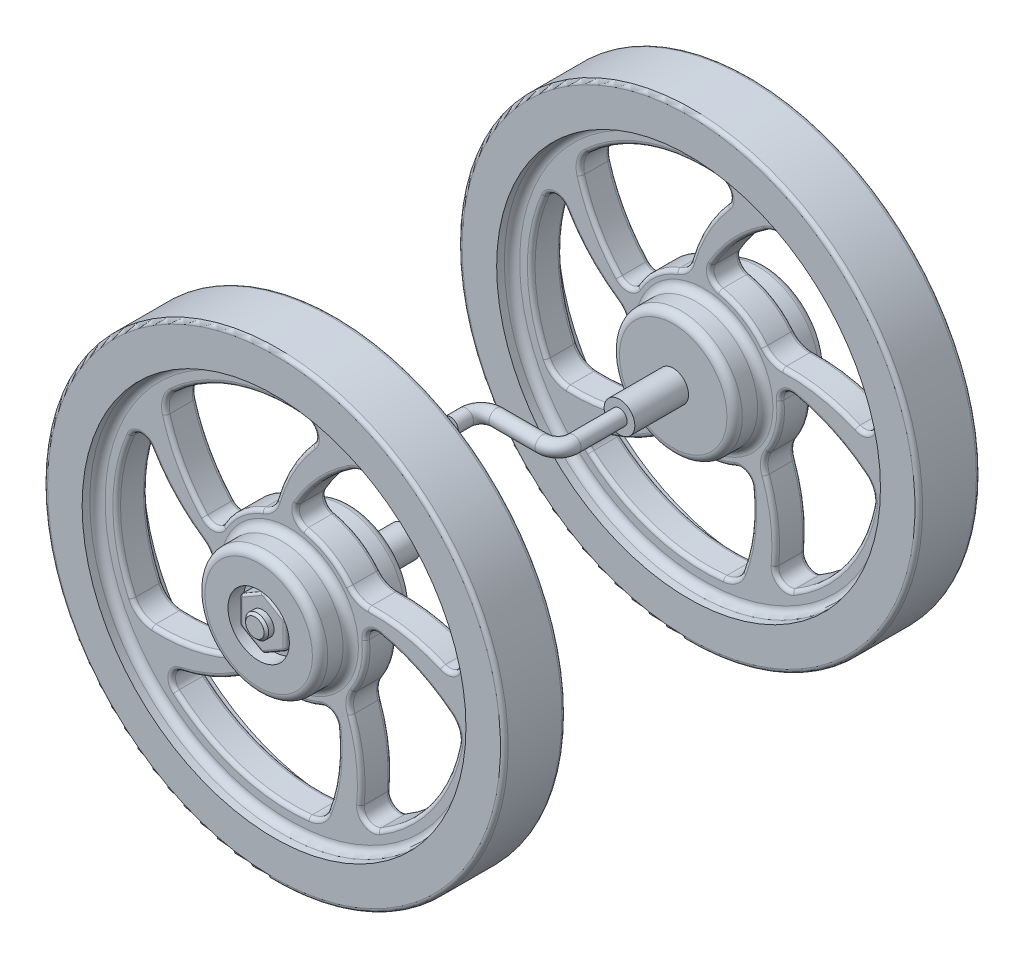
from build123d import *

# Parameters (mm, degrees)
SKETCH_2_R             = 10
SKETCH_3_W             = 5
SKETCH_3_H             = 40
SKETCH_4_W             = 70
SKETCH_4_H             = 20
FILLET_1_R             = 5
EXTRUDE_1_DEPTH        = 15
FILLET_2_R             = 3
FILLET_2_OF_MIRROR_1_R = 3
CUT_EXTRUDE_START      = -40
CUT_EXTRUDE_1_DEPTH    = 40
FILLET_3_R             = 5
FILLET_3_OF_MIRROR_3_R = 5


with BuildPart() as part:
    # По траектории1: sweep along a path in Эскиз1
    with BuildLine(Plane(origin=(0, 0, 0), x_dir=(1, 0, 0), z_dir=(0, 1, 0))) as sweep_1_path:
        Line((0, -140), (0, -80))
        ThreePointArc((0, -80), (-5.857864376, -65.857864376), (-20, -60))
        Line((-20, -60), (-80, -60))
        ThreePointArc((-80, -60), (-94.142135624, -54.142135624), (-100, -40))
        Line((-100, -40), (-100, 40))
        ThreePointArc((-100, 40), (-94.142135624, 54.142135624), (-80, 60))
        Line((-80, 60), (-20, 60))
        ThreePointArc((-20, 60), (-5.857864376, 65.857864376), (0, 80))
        Line((0, 80), (0, 140))
    # Эскиз2 → По траектории1 (sweep)
    with BuildSketch(Plane(origin=(0, 0, 140), x_dir=(-1, 0, 0), z_dir=(0, 0, -1))):
        Circle(SKETCH_2_R)
    sweep(path=sweep_1_path.line)

    # Эскиз3 → Вырез-Повернуть1 (revolve, cut)
    with BuildSketch(Plane(origin=(0, 0, 0), x_dir=(1, 0, 0), z_dir=(0, 1, 0)), mode=Mode.PRIVATE) as cut_revolve_1_sk:
        with Locations((-92.5, 0)):
            Rectangle(SKETCH_3_W, SKETCH_3_H)
    revolve(cut_revolve_1_sk.sketch.rotate(Axis((-100, 0, -40), (0, 0, 1)), 180), axis=Axis((-100, 0, -40), (0, 0, 1)), mode=Mode.SUBTRACT)

    # Эскиз4 → Повернуть1 (revolve)
    with BuildSketch(Plane(origin=(0, 0, 0), x_dir=(0, 0, -1), z_dir=(1, 0, 0)), mode=Mode.PRIVATE) as revolve_1_sk:
        with Locations((175, 10)):
            Rectangle(SKETCH_4_W, SKETCH_4_H)
        with Locations((-175, 10)):
            Rectangle(SKETCH_4_W, SKETCH_4_H)
    revolve(revolve_1_sk.sketch.rotate(Axis((0, 0, 305.598666539), (0, 0, -1)), 90), axis=Axis((0, 0, 305.598666539), (0, 0, -1)))

    # Эскиз5 → Повернуть2 (revolve)
    with BuildSketch(Plane(origin=(0, 0, 0), x_dir=(0, 0, -1), z_dir=(1, 0, 0)), mode=Mode.PRIVATE) as revolve_2_sk:
        with BuildLine():
            Line((-210, 0), (-210, 70))
            ThreePointArc((-210, 70), (-212.928932188, 77.071067812), (-220, 80))
            Line((-220, 80), (-240, 80))
            ThreePointArc((-240, 80), (-247.071067812, 82.928932188), (-250, 90))
            Line((-250, 90), (-250, 240))
            ThreePointArc((-250, 240), (-247.071067812, 247.071067812), (-240, 250))
            Line((-240, 250), (-230, 250))
            Line((-230, 250), (-230, 300))
            Line((-230, 300), (-310, 300))
            Line((-310, 300), (-310, 250))
            Line((-310, 250), (-300, 250))
            ThreePointArc((-300, 250), (-292.928932188, 247.071067812), (-290, 240))
            Line((-290, 240), (-290, 90))
            ThreePointArc((-290, 90), (-292.928932188, 82.928932188), (-300, 80))
            Line((-300, 80), (-320, 80))
            ThreePointArc((-320, 80), (-327.071067812, 77.071067812), (-330, 70))
            Line((-330, 70), (-330, 40))
            Line((-330, 40), (-310, 40))
            Line((-310, 40), (-310, 0))
            Line((-310, 0), (-210, 0))
        make_face()
        with BuildLine():
            Line((230, 250), (230, 300))
            Line((230, 300), (310, 300))
            Line((310, 300), (310, 250))
            Line((310, 250), (300, 250))
            ThreePointArc((300, 250), (292.928932188, 247.071067812), (290, 240))
            Line((290, 240), (290, 90))
            ThreePointArc((290, 90), (292.928932188, 82.928932188), (300, 80))
            Line((300, 80), (320, 80))
            ThreePointArc((320, 80), (327.071067812, 77.071067812), (330, 70))
            Line((330, 70), (330, 40))
            Line((330, 40), (310, 40))
            Line((310, 40), (310, 0))
            Line((310, 0), (210, 0))
            Line((210, 0), (210, 70))
            ThreePointArc((210, 70), (212.928932188, 77.071067812), (220, 80))
            Line((220, 80), (240, 80))
            ThreePointArc((240, 80), (247.071067812, 82.928932188), (250, 90))
            Line((250, 90), (250, 240))
            ThreePointArc((250, 240), (247.071067812, 247.071067812), (240, 250))
            Line((240, 250), (230, 250))
        make_face()
    revolve(revolve_2_sk.sketch.rotate(Axis((0, 0, 556.938315205), (0, 0, -1)), 90), axis=Axis((0, 0, 556.938315205), (0, 0, -1)))

    # Скругление1
    fillet_1_edges = [part.edges().sort_by_distance(p)[0] for p in [
        (-300, 0, -230),
        (-300, 0, -310),
        (-300, 0, 230),
        (-300, 0, 310),
    ]]
    fillet(fillet_1_edges, radius=FILLET_1_R)

    # Эскиз6 → Бобышка-Вытянуть1 (add)
    with BuildSketch(Plane.XY.offset(310)):
        with BuildLine():
            Line((-2.5, 33.197640478), (-27.5, 18.763883749))
            ThreePointArc((-27.5, 18.763883749), (-29.330127019, 16.93375673), (-30, 14.43375673))
            Line((-30, 14.43375673), (-30, -14.43375673))
            ThreePointArc((-30, -14.43375673), (-29.330127019, -16.93375673), (-27.5, -18.763883749))
            Line((-27.5, -18.763883749), (-2.5, -33.197640478))
            ThreePointArc((-2.5, -33.197640478), (0, -33.867513459), (2.5, -33.197640478))
            Line((2.5, -33.197640478), (27.5, -18.763883749))
            ThreePointArc((27.5, -18.763883749), (29.330127019, -16.93375673), (30, -14.43375673))
            Line((30, -14.43375673), (30, 14.43375673))
            ThreePointArc((30, 14.43375673), (29.330127019, 16.93375673), (27.5, 18.763883749))
            Line((27.5, 18.763883749), (2.5, 33.197640478))
            ThreePointArc((2.5, 33.197640478), (0, 33.867513459), (-2.5, 33.197640478))
        make_face()
    extrude_1 = extrude(amount=EXTRUDE_1_DEPTH)

    # Скругление2
    fillet_2_edges = [part.edges().sort_by_distance(p)[0] for p in [
        (30, 0, 325),
        (29.330127019, 16.93375673, 325),
        (15, 25.980762114, 325),
        (0, 33.867513459, 325),
        (-15, 25.980762114, 325),
        (-29.330127019, 16.93375673, 325),
        (-30, 0, 325),
        (-29.330127019, -16.93375673, 325),
        (-15, -25.980762114, 325),
        (0, -33.867513459, 325),
        (15, -25.980762114, 325),
        (29.330127019, -16.93375673, 325),
    ]]
    fillet(fillet_2_edges, radius=FILLET_2_R)

    # Зеркальное отражение1: Бобышка-Вытянуть1 across plane
    add(extrude_1.mirror(Plane.XY))

    # Скругление2 of Зеркальное отражение1
    fillet_2_of_mirror_1_edges = [part.edges().sort_by_distance(p)[0] for p in [
        (30, 0, -325),
        (29.330127019, 16.93375673, -325),
        (15, 25.980762114, -325),
        (0, 33.867513459, -325),
        (-15, 25.980762114, -325),
        (-29.330127019, 16.93375673, -325),
        (-30, 0, -325),
        (-29.330127019, -16.93375673, -325),
        (-15, -25.980762114, -325),
        (0, -33.867513459, -325),
        (15, -25.980762114, -325),
        (29.330127019, -16.93375673, -325),
    ]]
    fillet(fillet_2_of_mirror_1_edges, radius=FILLET_2_OF_MIRROR_1_R)

    # Эскиз7 → Повернуть3 (revolve)
    with BuildSketch(Plane(origin=(0, 0, 0), x_dir=(0, 0, -1), z_dir=(1, 0, 0)), mode=Mode.PRIVATE) as revolve_3_sk:
        Polygon((-325, 15), (-332, 15), (-335, 12), (-335, 0), (-325, 0), align=None)
        Polygon((325, 0), (335, 0), (335, 12), (332, 15), (325, 15), align=None)
    revolve(revolve_3_sk.sketch.rotate(Axis((0, 0, 417.512746567), (0, 0, -1)), 90), axis=Axis((0, 0, 417.512746567), (0, 0, -1)))

    # Эскиз8 → Вырез-Вытянуть1 (cut)
    with BuildSketch(Plane.XY.offset(290).offset(CUT_EXTRUDE_START)):
        with BuildLine():
            ThreePointArc((20.118614875, 97.955302743), (52.241504939, 85.269133698), (78.132929291, 62.411900791))
            ThreePointArc((78.132929291, 62.411900791), (89.046910737, 53.875575655), (102.632858675, 51.154205332))
            ThreePointArc((102.632858675, 51.154205332), (151.732398041, 47.375313267), (198.761338216, 32.769712379))
            ThreePointArc((198.761338216, 32.769712379), (214.338396594, 34.942139575), (219.413065105, 49.828775433))
            ThreePointArc((219.413065105, 49.828775433), (180.618591446, 134.171250364), (111.074665944, 195.671711255))
            ThreePointArc((111.074665944, 195.671711255), (95.222431523, 199.56403853), (79.678762106, 194.580276011))
            ThreePointArc((79.678762106, 194.580276011), (40.513348034, 161.409749919), (10.099384439, 120.067226059))
            ThreePointArc((10.099384439, 120.067226059), (9.473553871, 106.457762875), (20.118614875, 97.955302743))
        make_face()
        with BuildLine():
            ThreePointArc((117.311599162, 27.497727938), (104.174838235, 23.88737277), (99.378022879, 11.135913461))
            ThreePointArc((99.378022879, 11.135913461), (97.239278081, -23.335012285), (83.501647913, -55.022493544))
            ThreePointArc((83.501647913, -55.022493544), (78.75572601, -68.040176253), (80.365837829, -81.802130247))
            ThreePointArc((80.365837829, -81.802130247), (91.944489986, -129.666308977), (92.586479828, -178.906867872))
            ThreePointArc((92.586479828, -178.906867872), (99.466156631, -193.050213825), (115.19234748, -193.276286911))
            ThreePointArc((115.19234748, -193.276286911), (183.418656215, -130.31729184), (220.418815465, -45.172400745))
            ThreePointArc((220.418815465, -45.172400745), (219.222028848, -28.893234625), (209.678931025, -15.650393854))
            ThreePointArc((209.678931025, -15.650393854), (166.029107496, 11.347872138), (117.311599162, 27.497727938))
        make_face()
        with BuildLine():
            ThreePointArc((62.403171117, -103.07269558), (54.910036931, -91.694554601), (41.300380999, -91.072929728))
            ThreePointArc((41.300380999, -91.072929728), (7.855673956, -99.690964419), (-26.526072764, -96.417671947))
            ThreePointArc((-26.526072764, -96.417671947), (-40.373195254, -95.92671718), (-52.964039362, -101.710702177))
            ThreePointArc((-52.964039362, -101.710702177), (-94.907578152, -127.51349941), (-141.539746783, -143.340237544))
            ThreePointArc((-141.539746783, -143.340237544), (-152.864931066, -154.253733254), (-148.220279119, -169.280089963))
            ThreePointArc((-148.220279119, -169.280089963), (-67.259627734, -214.711766042), (25.151653773, -223.589790269))
            ThreePointArc((25.151653773, -223.589790269), (40.264233388, -217.421039573), (49.909943992, -204.25275135))
            ThreePointArc((49.909943992, -204.25275135), (62.09828352, -154.396379238), (62.403171117, -103.07269558))
        make_face()
        with BuildLine():
            ThreePointArc((-78.744318406, -91.200157119), (-70.238569088, -80.557724097), (-73.852983673, -67.422079488))
            ThreePointArc((-73.852983673, -67.422079488), (-92.384204571, -38.277392097), (-99.89566247, -4.566904835))
            ThreePointArc((-99.89566247, -4.566904835), (-103.707732911, 8.754204607), (-113.099414337, 18.941459282))
            ThreePointArc((-113.099414337, 18.941459282), (-150.600599074, 50.858632317), (-180.062854099, 90.317729114))
            ThreePointArc((-180.062854099, 90.317729114), (-193.941879718, 97.716163782), (-206.797517797, 88.655437695))
            ThreePointArc((-206.797517797, 88.655437695), (-224.987392225, -2.381877359), (-204.87423856, -93.013689178))
            ThreePointArc((-204.87423856, -93.013689178), (-194.337364083, -105.4803577), (-178.832889261, -110.584748776))
            ThreePointArc((-178.832889261, -110.584748776), (-127.650257637, -106.770082247), (-78.744318406, -91.200157119))
        make_face()
        with BuildLine():
            ThreePointArc((-111.069836313, 46.707898701), (-98.319859949, 41.907143052), (-86.94403508, 49.403793012))
            ThreePointArc((-86.94403508, 49.403793012), (-64.952252405, 76.034235102), (-35.21284197, 93.595169535))
            ThreePointArc((-35.21284197, 93.595169535), (-23.721708582, 101.337113171), (-16.935242805, 113.41716781))
            ThreePointArc((-16.935242805, 113.41716781), (1.831289198, 158.945862804), (30.254782839, 199.159663923))
            ThreePointArc((30.254782839, 199.159663923), (33.002257559, 214.645643722), (20.412384331, 224.072163746))
            ThreePointArc((20.412384331, 224.072163746), (-71.790227701, 213.239684877), (-151.770896622, 166.104168938))
            ThreePointArc((-151.770896622, 166.104168938), (-160.371329676, 152.230593369), (-160.434747862, 135.907617969))
            ThreePointArc((-160.434747862, 135.907617969), (-140.990481413, 88.408839428), (-111.069836313, 46.707898701))
        make_face()
    cut_extrude_1 = extrude(amount=CUT_EXTRUDE_1_DEPTH, mode=Mode.SUBTRACT)

    # Скругление3
    fillet_3_edges = [part.edges().sort_by_distance(p)[0] for p in [
        (183.418656215, -130.31729184, 290),
        (219.222028848, -28.893234625, 290),
        (166.029107496, 11.347872138, 290),
        (104.174838235, 23.88737277, 290),
        (97.239278081, -23.335012285, 290),
        (78.75572601, -68.040176253, 290),
        (91.944489986, -129.666308977, 290),
        (99.466156631, -193.050213825, 290),
        (183.418656215, -130.31729184, 250),
        (99.466156631, -193.050213825, 250),
        (91.944489986, -129.666308977, 250),
        (78.75572601, -68.040176253, 250),
        (97.239278081, -23.335012285, 250),
        (104.174838235, 23.88737277, 250),
        (166.029107496, 11.347872138, 250),
        (219.222028848, -28.893234625, 250),
        (-67.259627734, -214.711766042, 290),
        (40.264233388, -217.421039573, 290),
        (62.09828352, -154.396379238, 290),
        (54.910036931, -91.694554601, 290),
        (7.855673956, -99.690964419, 290),
        (-40.373195254, -95.92671718, 290),
        (-94.907578152, -127.51349941, 290),
        (-152.864931066, -154.253733254, 290),
        (-67.259627734, -214.711766042, 250),
        (-152.864931066, -154.253733254, 250),
        (-94.907578152, -127.51349941, 250),
        (-40.373195254, -95.92671718, 250),
        (7.855673956, -99.690964419, 250),
        (54.910036931, -91.694554601, 250),
        (62.09828352, -154.396379238, 250),
        (40.264233388, -217.421039573, 250),
        (-71.790227701, 213.239684877, 290),
        (-160.371329676, 152.230593369, 290),
        (-140.990481413, 88.408839428, 290),
        (-98.319859949, 41.907143052, 290),
        (-64.952252405, 76.034235102, 290),
        (-23.721708582, 101.337113171, 290),
        (1.831289198, 158.945862804, 290),
        (33.002257559, 214.645643722, 290),
        (-71.790227701, 213.239684877, 250),
        (33.002257559, 214.645643722, 250),
        (1.831289198, 158.945862804, 250),
        (-23.721708582, 101.337113171, 250),
        (-64.952252405, 76.034235102, 250),
        (-98.319859949, 41.907143052, 250),
        (-140.990481413, 88.408839428, 250),
        (-160.371329676, 152.230593369, 250),
        (-224.987392225, -2.381877359, 290),
        (-194.337364083, -105.4803577, 290),
        (-127.650257637, -106.770082247, 290),
        (-70.238569088, -80.557724097, 290),
        (-92.384204571, -38.277392097, 290),
        (-103.707732911, 8.754204607, 290),
        (-150.600599074, 50.858632317, 290),
        (-193.941879718, 97.716163782, 290),
        (-224.987392225, -2.381877359, 250),
        (-193.941879718, 97.716163782, 250),
        (-150.600599074, 50.858632317, 250),
        (-103.707732911, 8.754204607, 250),
        (-92.384204571, -38.277392097, 250),
        (-70.238569088, -80.557724097, 250),
        (-127.650257637, -106.770082247, 250),
        (-194.337364083, -105.4803577, 250),
        (95.222431523, 199.56403853, 290),
        (40.513348034, 161.409749919, 290),
        (9.473553871, 106.457762875, 290),
        (52.241504939, 85.269133698, 290),
        (89.046910737, 53.875575655, 290),
        (151.732398041, 47.375313267, 290),
        (214.338396594, 34.942139575, 290),
        (180.618591446, 134.171250364, 290),
        (95.222431523, 199.56403853, 250),
        (180.618591446, 134.171250364, 250),
        (214.338396594, 34.942139575, 250),
        (151.732398041, 47.375313267, 250),
        (89.046910737, 53.875575655, 250),
        (52.241504939, 85.269133698, 250),
        (9.473553871, 106.457762875, 250),
        (40.513348034, 161.409749919, 250),
    ]]
    fillet(fillet_3_edges, radius=FILLET_3_R)

    # Зеркальное отражение3: Вырез-Вытянуть1 across plane
    add(cut_extrude_1.mirror(Plane.XY), mode=Mode.SUBTRACT)

    # Скругление3 of Зеркальное отражение3
    fillet_3_of_mirror_3_edges = [part.edges().sort_by_distance(p)[0] for p in [
        (183.418656215, -130.31729184, -290),
        (219.222028848, -28.893234625, -290),
        (166.029107496, 11.347872138, -290),
        (104.174838235, 23.88737277, -290),
        (97.239278081, -23.335012285, -290),
        (78.75572601, -68.040176253, -290),
        (91.944489986, -129.666308977, -290),
        (99.466156631, -193.050213825, -290),
        (183.418656215, -130.31729184, -250),
        (99.466156631, -193.050213825, -250),
        (91.944489986, -129.666308977, -250),
        (78.75572601, -68.040176253, -250),
        (97.239278081, -23.335012285, -250),
        (104.174838235, 23.88737277, -250),
        (166.029107496, 11.347872138, -250),
        (219.222028848, -28.893234625, -250),
        (-67.259627734, -214.711766042, -290),
        (40.264233388, -217.421039573, -290),
        (62.09828352, -154.396379238, -290),
        (54.910036931, -91.694554601, -290),
        (7.855673956, -99.690964419, -290),
        (-40.373195254, -95.92671718, -290),
        (-94.907578152, -127.51349941, -290),
        (-152.864931066, -154.253733254, -290),
        (-67.259627734, -214.711766042, -250),
        (-152.864931066, -154.253733254, -250),
        (-94.907578152, -127.51349941, -250),
        (-40.373195254, -95.92671718, -250),
        (7.855673956, -99.690964419, -250),
        (54.910036931, -91.694554601, -250),
        (62.09828352, -154.396379238, -250),
        (40.264233388, -217.421039573, -250),
        (-71.790227701, 213.239684877, -290),
        (-160.371329676, 152.230593369, -290),
        (-140.990481413, 88.408839428, -290),
        (-98.319859949, 41.907143052, -290),
        (-64.952252405, 76.034235102, -290),
        (-23.721708582, 101.337113171, -290),
        (1.831289198, 158.945862804, -290),
        (33.002257559, 214.645643722, -290),
        (-71.790227701, 213.239684877, -250),
        (33.002257559, 214.645643722, -250),
        (1.831289198, 158.945862804, -250),
        (-23.721708582, 101.337113171, -250),
        (-64.952252405, 76.034235102, -250),
        (-98.319859949, 41.907143052, -250),
        (-140.990481413, 88.408839428, -250),
        (-160.371329676, 152.230593369, -250),
        (-224.987392225, -2.381877359, -290),
        (-194.337364083, -105.4803577, -290),
        (-127.650257637, -106.770082247, -290),
        (-70.238569088, -80.557724097, -290),
        (-92.384204571, -38.277392097, -290),
        (-103.707732911, 8.754204607, -290),
        (-150.600599074, 50.858632317, -290),
        (-193.941879718, 97.716163782, -290),
        (-224.987392225, -2.381877359, -250),
        (-193.941879718, 97.716163782, -250),
        (-150.600599074, 50.858632317, -250),
        (-103.707732911, 8.754204607, -250),
        (-92.384204571, -38.277392097, -250),
        (-70.238569088, -80.557724097, -250),
        (-127.650257637, -106.770082247, -250),
        (-194.337364083, -105.4803577, -250),
        (95.222431523, 199.56403853, -290),
        (40.513348034, 161.409749919, -290),
        (9.473553871, 106.457762875, -290),
        (52.241504939, 85.269133698, -290),
        (89.046910737, 53.875575655, -290),
        (151.732398041, 47.375313267, -290),
        (214.338396594, 34.942139575, -290),
        (180.618591446, 134.171250364, -290),
        (95.222431523, 199.56403853, -250),
        (180.618591446, 134.171250364, -250),
        (214.338396594, 34.942139575, -250),
        (151.732398041, 47.375313267, -250),
        (89.046910737, 53.875575655, -250),
        (52.241504939, 85.269133698, -250),
        (9.473553871, 106.457762875, -250),
        (40.513348034, 161.409749919, -250),
    ]]
    fillet(fillet_3_of_mirror_3_edges, radius=FILLET_3_OF_MIRROR_3_R)


solid = part.part
